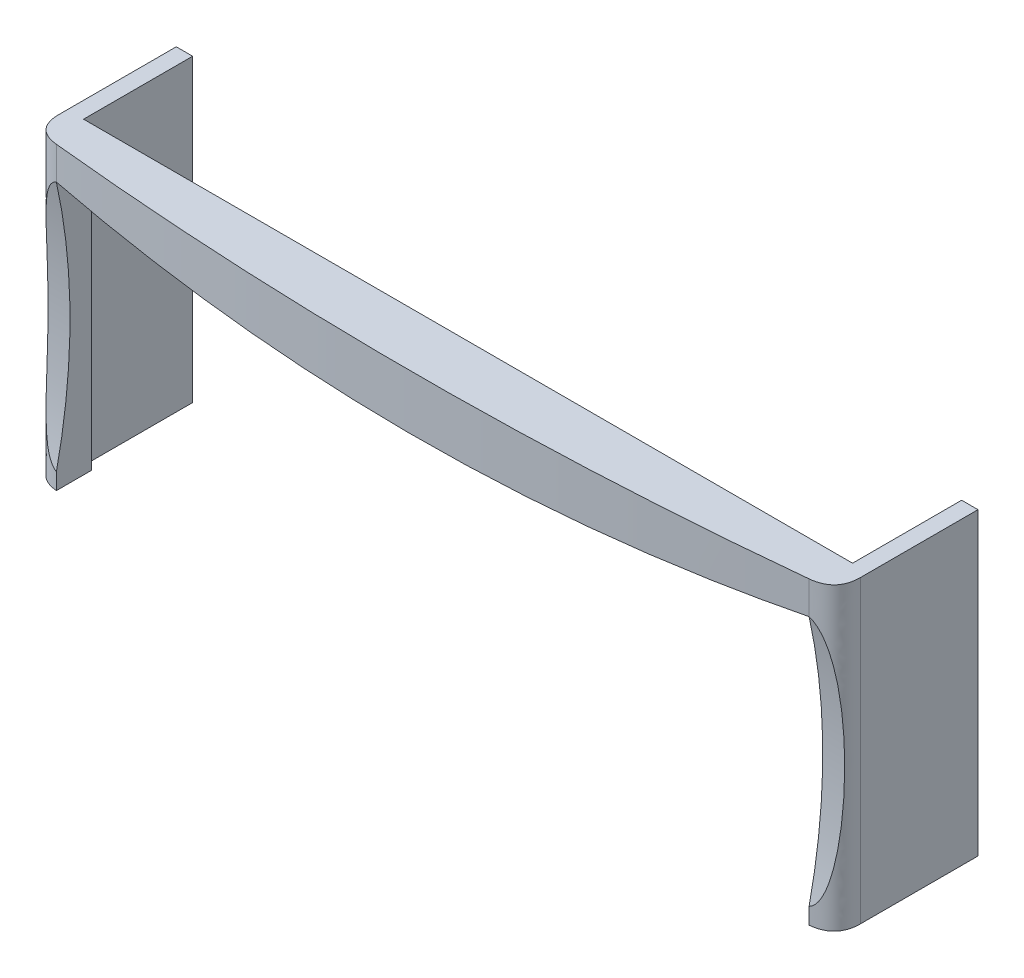
from build123d import *

# Parameters (mm, degrees)
BOSS_EXTRUDE1_DEPTH     = 55
CUT_EXTRUDE1_DEPTH      = 95.637466314
CUT_EXTRUDE1_DEPTH_BACK = 95.637466314
CUT_EXTRUDE2_DEPTH      = 158.489682338
CUT_EXTRUDE2_DEPTH_BACK = 158.489682338
SKETCH4_W               = 3
SKETCH4_H               = 55
BOSS_EXTRUDE2_DEPTH     = 10


with BuildPart() as part:
    # Sketch1 → Boss-Extrude1 (new body)
    with BuildSketch(Plane(origin=(0, 0, 0), x_dir=(1, 0, 0), z_dir=(0, 1, 0))):
        with BuildLine():
            Line((-73.5, 3), (-73.5, 13))
            Line((-73.5, 13), (-70.5, 13))
            Line((-70.5, 13), (-70.5, 3))
            Line((-70.5, 3), (70.5, 3))
            Line((70.5, 3), (70.5, 13))
            Line((70.5, 13), (73.5, 13))
            Line((73.5, 13), (73.5, 3))
            Line((73.5, 3), (73.5, -3))
            ThreePointArc((73.5, -3), (0, -7), (-73.5, -3))
            Line((-73.5, -3), (-73.5, 3))
        make_face()
    extrude(amount=BOSS_EXTRUDE1_DEPTH)

    # Fillet1
    # a fillet whose section is not a circle: 5 mm, written as the material it takes off along each edge
    with BuildSketch(Plane(origin=(73.5, -11.289002285, 3), x_dir=(0, 0, -1), z_dir=(0, 1, 0))) as fillet1_piece_1:
        with BuildLine():
            Bezier((4.498901921, 0), (-0.015132067, 0), (-0.475075473, 4.490540603), weights=[1, 1, 1])
            ThreePointArc((-0.475075473, 4.490540603), (-0.24128019, 2.24487437), (0, 0))
            Line((0, 0), (4.498901921, 0))
        make_face()
    extrude(amount=77.578004571, mode=Mode.SUBTRACT)
    with BuildSketch(Plane(origin=(-73.5, -11.289002285, 3), x_dir=(0, 0, -1), z_dir=(0, 1, 0))) as fillet1_piece_2:
        with BuildLine():
            Bezier((4.498901921, 0), (-0.015132067, 0), (-0.475075473, -4.490540603), weights=[1, 1, 1])
            ThreePointArc((-0.475075473, -4.490540603), (-0.24128019, -2.24487437), (0, 0))
            Line((0, 0), (4.498901921, 0))
        make_face()
    extrude(amount=77.578004571, mode=Mode.SUBTRACT)

    # Sketch2 → Cut-Extrude1 (cut, two sides: drawn at the far end of the back side and taken through both)
    with BuildSketch(Plane.XY.offset(10).offset(-CUT_EXTRUDE1_DEPTH_BACK)):
        with BuildLine():
            Line((-69.009459397, 49), (-69.009459397, 0))
            Line((-69.009459397, 0), (69.009459397, 0))
            Line((69.009459397, 0), (69.009459397, 49))
            ThreePointArc((69.009459397, 49), (0, 45), (-69.009459397, 49))
        make_face()
    extrude(amount=CUT_EXTRUDE1_DEPTH + CUT_EXTRUDE1_DEPTH_BACK, mode=Mode.SUBTRACT)

    # Sketch3 → Cut-Extrude2 (cut, two sides: drawn at the far end of the back side and taken through both)
    with BuildSketch(Plane.ZY.offset(73.5).offset(-CUT_EXTRUDE2_DEPTH_BACK)):
        with BuildLine():
            Line((3.475075473, 49), (3.475075473, 3))
            ThreePointArc((3.475075473, 3), (0.975075473, 26), (3.475075473, 49))
        make_face()
    extrude(amount=CUT_EXTRUDE2_DEPTH + CUT_EXTRUDE2_DEPTH_BACK, mode=Mode.SUBTRACT)

    # Sketch4 → Boss-Extrude2 (add)
    with BuildSketch(Plane(origin=(0, 0, -13), x_dir=(-1, 0, 0), z_dir=(0, 0, -1))):
        with Locations((72, 27.5)):
            Rectangle(SKETCH4_W, SKETCH4_H)
        with Locations((-72, 27.5)):
            Rectangle(SKETCH4_W, SKETCH4_H)
    extrude(amount=BOSS_EXTRUDE2_DEPTH)


solid = part.part
